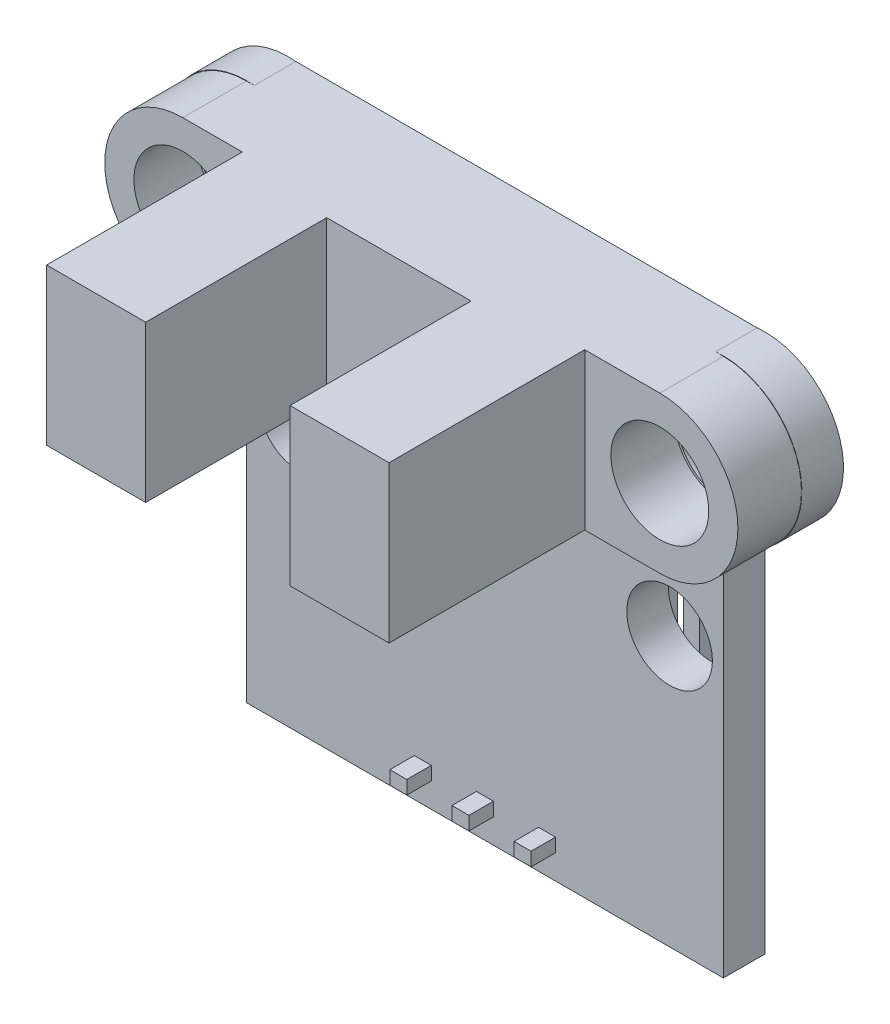
from build123d import *

# Parameters (mm, degrees)
IZIM1_R                     = 1.900647948
IZIM1_R_2                   = 1.75
Y_KSEKLIK_EKSTR_ZYON1_DEPTH = 1.7
IZIM2_R                     = 2
Y_KSEKLIK_EKSTR_ZYON2_DEPTH = 2.6
IZIM3_W                     = 4.050055298
IZIM3_H                     = 6.384195941
Y_KSEKLIK_EKSTR_ZYON3_DEPTH = 8
IZIM4_W                     = 5.9
IZIM4_H                     = 6.384195941
Y_KSEKLIK_EKSTR_ZYON4_DEPTH = 0.6
Y_KSEKLIK_EKSTR_ZYON6_DEPTH = 2.54
IZIM6_W                     = 19.5
IZIM6_H                     = 1.7
Y_KSEKLIK_EKSTR_ZYON7_DEPTH = 0.01
KES_EKSTR_ZYON1_DEPTH       = 5.9
KES_EKSTR_ZYON1_DEPTH_BACK  = 0.1
IZIM7_W                     = 6.75
IZIM7_H                     = 0.75
IZIM8_W                     = 0.664910115
IZIM8_H                     = 0.664910116
IZIM11_W                    = 0.693181836
IZIM11_H                    = 0.554146416
Y_KSEKLIK_EKSTR_ZYON8_DEPTH = 1
Y_KSEKLIK_EKSTR_ZYON9_DEPTH = 1.5


with BuildPart() as part:
    # Çizim1 → Yükseklik-Ekstrüzyon1 (new body)
    with BuildSketch(Plane.XY):
        with BuildLine():
            Line((-9.431965443, -11), (10.068034557, -11))
            Line((10.068034557, -11), (10.068034557, 4.6))
            ThreePointArc((10.068034557, 4.6), (13.271983136, 7.967115525), (9.75, 11))
            Line((9.75, 11), (-9.113930886, 11))
            ThreePointArc((-9.113930886, 11), (-12.635914021, 7.967115525), (-9.431965443, 4.6))
            Line((-9.431965443, 4.6), (-9.431965443, -11))
        make_face()
        with Locations((10.068034557, 7.80790203)):
            Circle(IZIM1_R, mode=Mode.SUBTRACT)
        with Locations((-9.431965443, 7.80790203)):
            Circle(IZIM1_R, mode=Mode.SUBTRACT)
        with Locations((7.868034557, 0)):
            Circle(IZIM1_R_2, mode=Mode.SUBTRACT)
        with Locations((-7.231965443, 0)):
            Circle(IZIM1_R_2, mode=Mode.SUBTRACT)
    extrude(amount=Y_KSEKLIK_EKSTR_ZYON1_DEPTH)

    # Çizim2 → Yükseklik-Ekstrüzyon2 (add)
    with BuildSketch(Plane.XY.offset(1.7)):
        with BuildLine():
            Line((-9.431965443, 11), (10.068034557, 11))
            ThreePointArc((10.068034557, 11), (13.260132528, 7.80790203), (10.068034557, 4.615804059))
            Line((10.068034557, 4.615804059), (-9.431965443, 4.615804059))
            ThreePointArc((-9.431965443, 4.615804059), (-12.624063413, 7.80790203), (-9.431965443, 11))
        make_face()
        with Locations((-9.431965443, 7.80790203)):
            Circle(IZIM2_R, mode=Mode.SUBTRACT)
        with Locations((10.068034557, 7.80790203)):
            Circle(IZIM2_R, mode=Mode.SUBTRACT)
    extrude(amount=Y_KSEKLIK_EKSTR_ZYON2_DEPTH)

    # Çizim3 → Yükseklik-Ekstrüzyon3 (add)
    with BuildSketch(Plane.XY.offset(4.3)):
        with Locations((4.975027649, 7.80790203)):
            Rectangle(IZIM3_W, IZIM3_H)
        with Locations((-4.975027649, 7.80790203)):
            Rectangle(IZIM3_W, IZIM3_H)
    extrude(amount=Y_KSEKLIK_EKSTR_ZYON3_DEPTH)

    # Çizim4 → Yükseklik-Ekstrüzyon4 (add)
    with BuildSketch(Plane.XY.offset(4.3)):
        with Locations((0, 7.80790203)):
            Rectangle(IZIM4_W, IZIM4_H)
    extrude(amount=Y_KSEKLIK_EKSTR_ZYON4_DEPTH)

    # Çizim5 → Yükseklik-Ekstrüzyon6 (add)
    with BuildSketch(Plane(origin=(0, 0, 0), x_dir=(-1, 0, 0), z_dir=(0, 0, -1))):
        Polygon((0.951965443, -8.71), (0.701965443, -8.46), (-1.338034557, -8.46), (-1.588034557, -8.71), (-1.838034557, -8.46), (-3.878034557, -8.46), (-4.128034557, -8.71), (-4.128034557, -10.75), (-3.878034557, -11), (-1.838034557, -11), (-1.588034557, -10.75), (-1.338034557, -11), (0.701965443, -11), (0.951965443, -10.75), (1.201965443, -11), (3.241965443, -11), (3.491965443, -10.75), (3.491965443, -8.71), (3.241965443, -8.46), (1.201965443, -8.46), align=None)
    extrude(amount=Y_KSEKLIK_EKSTR_ZYON6_DEPTH)

    # Çizim6 → Yükseklik-Ekstrüzyon7 (add)
    with BuildSketch(Plane.XZ.offset(11)):
        with Locations((0.318034557, 0.85)):
            Rectangle(IZIM6_W, IZIM6_H)
    extrude(amount=Y_KSEKLIK_EKSTR_ZYON7_DEPTH)

    # Çizim7 → Kes-Ekstrüzyon1 (cut, two sides: drawn at the far end of the back side and taken through both)
    with BuildSketch(Plane.ZY.offset(-2.95).offset(-KES_EKSTR_ZYON1_DEPTH_BACK)):
        with Locations((8.275, 7.80790203)):
            Rectangle(IZIM7_W, IZIM7_H)
    extrude(amount=KES_EKSTR_ZYON1_DEPTH + KES_EKSTR_ZYON1_DEPTH_BACK, mode=Mode.SUBTRACT)

    # Süpür1: sweep along a path in Çizim9
    with BuildLine(Plane(origin=(0, 0, 0), x_dir=(0, 0, -1), z_dir=(1, 0, 0))) as s_p_r1_path:
        Line((2.54, -9.73), (4.04, -9.73))
        ThreePointArc((4.04, -9.73), (4.393553391, -9.583553391), (4.54, -9.23))
        Line((4.54, -9.23), (4.54, -3.305))
    # Çizim8 → Süpür1 (sweep)
    with BuildSketch(Plane(origin=(0, 0, -2.54), x_dir=(-1, 0, 0), z_dir=(0, 0, -1))):
        with Locations((2.221965443, -9.73)):
            Rectangle(IZIM8_W, IZIM8_H)
        with Locations((-0.318034558, -9.73)):
            Rectangle(IZIM8_W, IZIM8_H)
        with Locations((-2.858034557, -9.73)):
            Rectangle(IZIM8_W, IZIM8_H)
    sweep(path=s_p_r1_path.line)

    # Çizim11 → Yükseklik-Ekstrüzyon8 (add)
    with BuildSketch(Plane.XY.offset(1.7)):
        with Locations((-2.221965443, -9.73)):
            Rectangle(IZIM11_W, IZIM11_H)
        with Locations((0.318034557, -9.73)):
            Rectangle(IZIM11_W, IZIM11_H)
        with Locations((2.858034557, -9.73)):
            Rectangle(IZIM11_W, IZIM11_H)
    extrude(amount=Y_KSEKLIK_EKSTR_ZYON8_DEPTH)

    # Çizim12 → Yükseklik-Ekstrüzyon9 (add)
    with BuildSketch(Plane(origin=(0, 0, 0), x_dir=(-1, 0, 0), z_dir=(0, 0, -1))):
        Polygon((-4.998159683, 0), (-4.998159683, 2.331223734), (-1.20341454, 2.331223734), (-1.20341454, -3.045965908), (-4.998159683, -3.045965908), align=None)
    extrude(amount=Y_KSEKLIK_EKSTR_ZYON9_DEPTH)


solid = part.part
